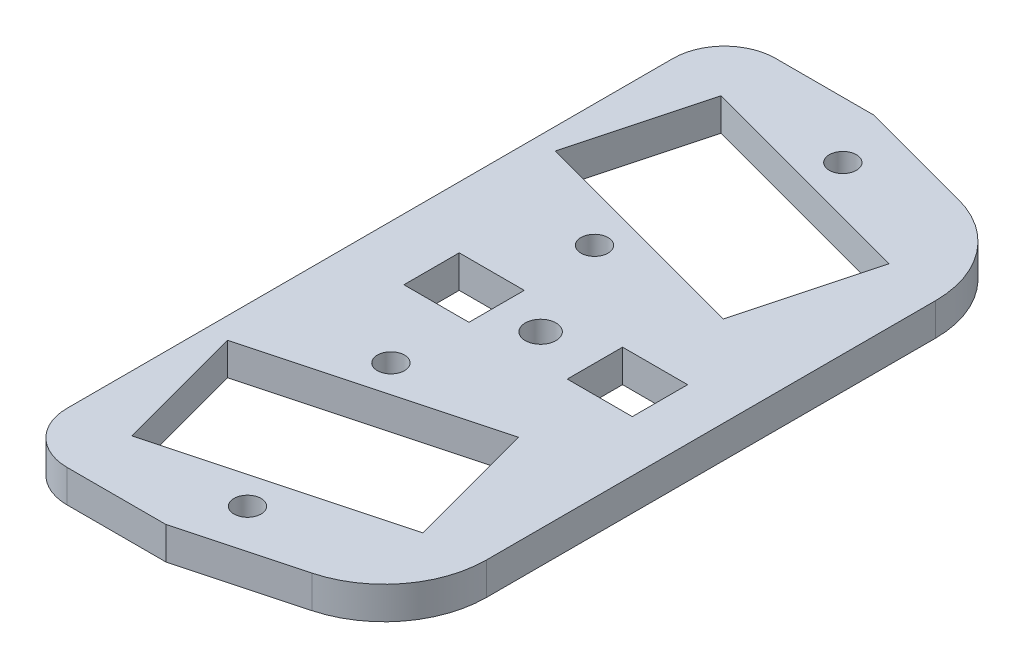
from build123d import *

# Parameters (mm, degrees)
SKETCH1_R           = 1.324800001
SKETCH1_R_2         = 1.5
SKETCH1_W           = 6.35
SKETCH1_H           = 5.4
BOSS_EXTRUDE1_DEPTH = 3.175


with BuildPart() as part:
    # Sketch1 → Boss-Extrude1 (new body)
    with BuildSketch(Plane(origin=(0, 0, 0), x_dir=(1, 0, 0), z_dir=(0, 1, 0))):
        with BuildLine():
            Line((242.25748173, 29.781172289), (251.897227692, 29.781172289))
            Line((251.897227692, 29.781172289), (263.145672181, 26.767160672))
            ThreePointArc((263.145672181, 26.767160672), (268.491015133, 23.1955167), (270.55748173, 17.10790241))
            Line((270.55748173, 17.10790241), (270.55748173, -26.721464525))
            ThreePointArc((270.55748173, -26.721464525), (268.491015133, -32.809078815), (263.145672181, -36.380722788))
            Line((263.145672181, -36.380722788), (251.897227692, -39.394734405))
            Line((251.897227692, -39.394734405), (242.25748173, -39.394734405))
            ThreePointArc((242.25748173, -39.394734405), (238.721947824, -37.930268311), (237.25748173, -34.394734405))
            Line((237.25748173, -34.394734405), (237.25748173, 24.781172289))
            ThreePointArc((237.25748173, 24.781172289), (238.721947824, 28.316706195), (242.25748173, 29.781172289))
        make_face()
        with Locations((254.350862197, 24.256669994)):
            Circle(SKETCH1_R, mode=Mode.SUBTRACT)
        with Locations((249.226245104, 5.131338633)):
            Circle(SKETCH1_R, mode=Mode.SUBTRACT)
        with Locations((249.226245104, -14.744900749)):
            Circle(SKETCH1_R, mode=Mode.SUBTRACT)
        with Locations((254.350862197, -33.870232109)):
            Circle(SKETCH1_R, mode=Mode.SUBTRACT)
        with Locations((253.90748173, -4.806781058)):
            Circle(SKETCH1_R_2, mode=Mode.SUBTRACT)
        Polygon((239.331363168, 11.197820789), (261.740842338, 5.193218942), (265.157881165, 17.945781457), (242.748401995, 23.950383303), align=None, mode=Mode.SUBTRACT)
        Polygon((261.740842338, -14.806781058), (265.157881165, -27.559343572), (242.748401995, -33.563945419), (239.331363168, -20.811382904), align=None, mode=Mode.SUBTRACT)
        with Locations((246.43248173, -4.806781058)):
            Rectangle(SKETCH1_W, SKETCH1_H, mode=Mode.SUBTRACT)
        with Locations((262.38248173, -4.806781058)):
            Rectangle(SKETCH1_W, SKETCH1_H, mode=Mode.SUBTRACT)
    extrude(amount=BOSS_EXTRUDE1_DEPTH)


solid = part.part
